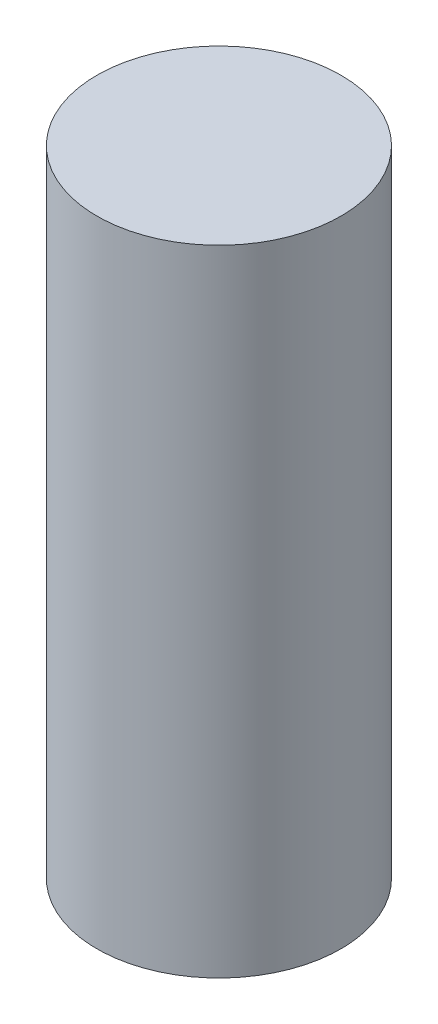
from build123d import *

# Parameters (mm, degrees)
SKETCH1_R           = 2.5
BOSS_EXTRUDE1_DEPTH = 13


with BuildPart() as part:
    # Sketch1 → Boss-Extrude1 (new body)
    with BuildSketch(Plane(origin=(0, 0, 0), x_dir=(1, 0, 0), z_dir=(0, 1, 0))):
        Circle(SKETCH1_R)
    extrude(amount=BOSS_EXTRUDE1_DEPTH)


solid = part.part
